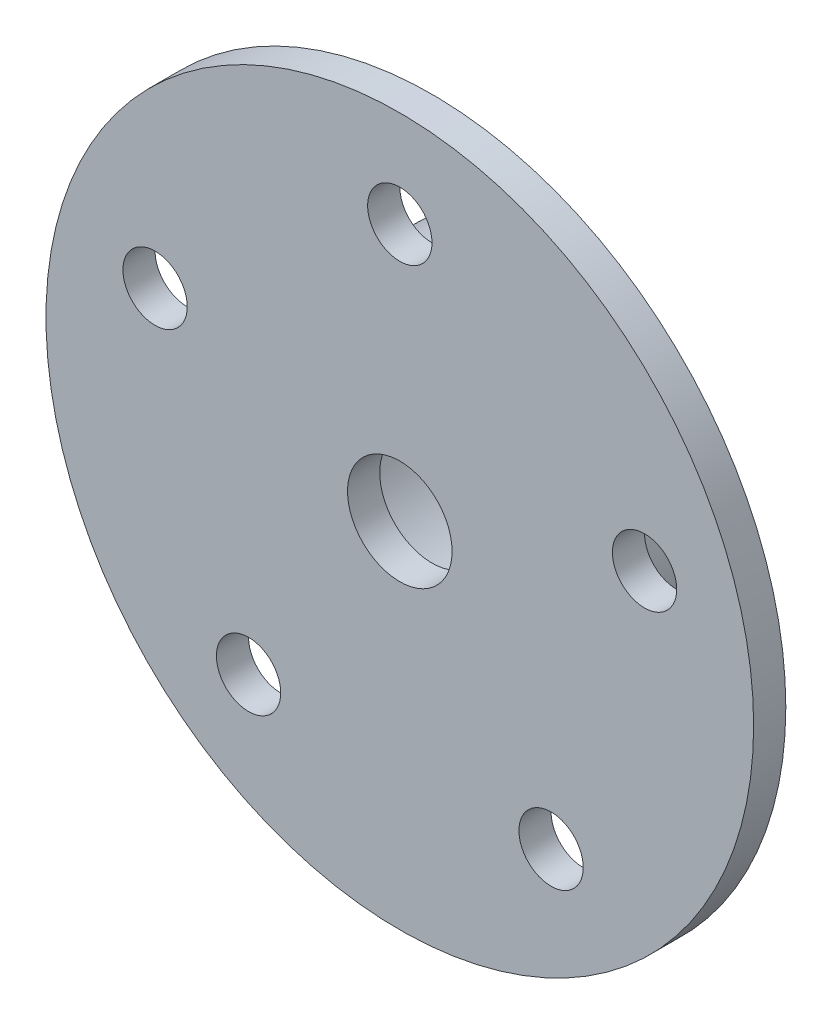
from build123d import *

# Parameters (mm, degrees)
SKETCH_1_R      = 22
SKETCH_1_R_2    = 3.25
SKETCH_1_R_3    = 2
EXTRUDE_1_DEPTH = 2
SKETCH_3_R      = 11
SKETCH_3_R_2    = 7.6
EXTRUDE_2_DEPTH = 7


with BuildPart() as part:
    # 草图1 → 凸台-拉伸1 (new body)
    with BuildSketch(Plane.XY):
        Circle(SKETCH_1_R)
        Circle(SKETCH_1_R_2, mode=Mode.SUBTRACT)
        with Locations((0, 16)):
            Circle(SKETCH_1_R_3, mode=Mode.SUBTRACT)
        with Locations((15.216904261, 4.94427191)):
            Circle(SKETCH_1_R_3, mode=Mode.SUBTRACT)
        with Locations((9.404564037, -12.94427191)):
            Circle(SKETCH_1_R_3, mode=Mode.SUBTRACT)
        with Locations((-9.404564037, -12.94427191)):
            Circle(SKETCH_1_R_3, mode=Mode.SUBTRACT)
        with Locations((-15.216904261, 4.94427191)):
            Circle(SKETCH_1_R_3, mode=Mode.SUBTRACT)
    extrude(amount=EXTRUDE_1_DEPTH)

    # 草图3 → 凸台-拉伸2 (add)
    with BuildSketch(Plane(origin=(0, 0, 0), x_dir=(-1, 0, 0), z_dir=(0, 0, -1))):
        Circle(SKETCH_3_R)
        Circle(SKETCH_3_R_2, mode=Mode.SUBTRACT)
    extrude(amount=EXTRUDE_2_DEPTH)


solid = part.part
